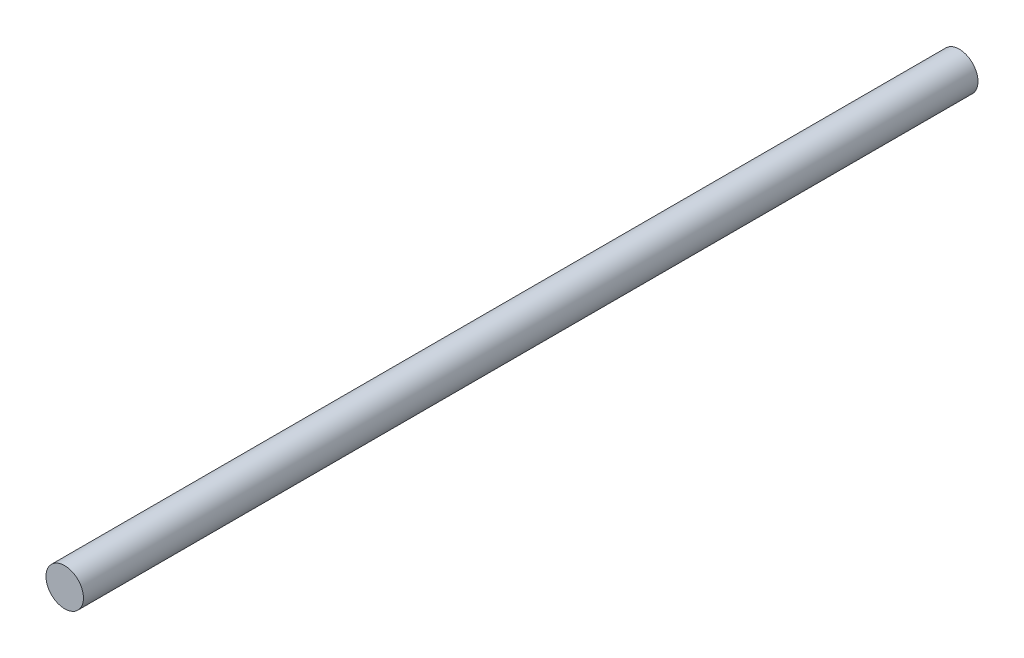
from build123d import *

# Parameters (mm, degrees)
SKETCH1_R           = 8
BOSS_EXTRUDE1_DEPTH = 191


with BuildPart() as part:
    # Sketch1 → Boss-Extrude1 (new, symmetric)
    with BuildSketch(Plane.XY):
        Circle(SKETCH1_R)
    extrude(amount=BOSS_EXTRUDE1_DEPTH, both=True)


solid = part.part
